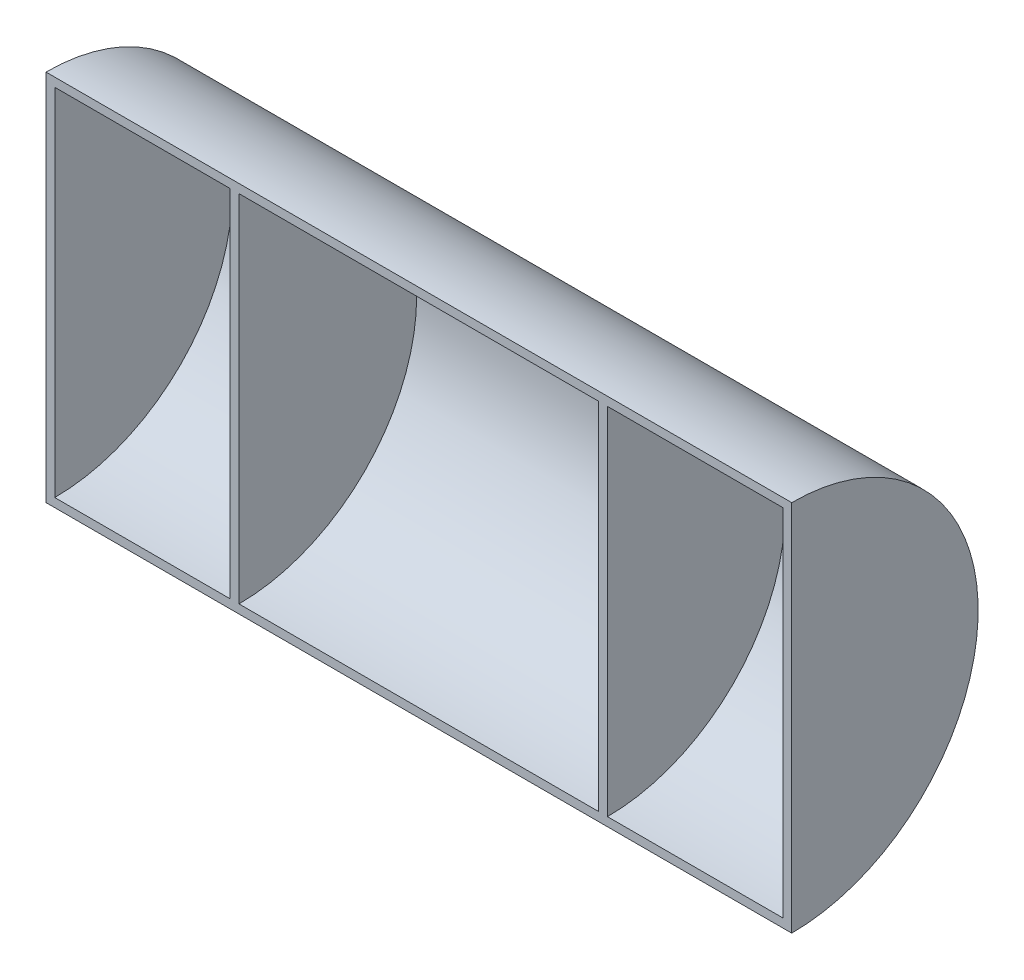
from build123d import *

# Parameters (mm, degrees)
PROFILE_EXTRUDE_DEPTH      = 170
PROFILE_SHELL_T            = -2
SUPPORT_EXTRUDE_REACH      = 182.312
SUPPORT_EXTRUDE_END_RADIUS = 40.5
SUPPORT_SKETCH_W           = 2
SUPPORT_SKETCH_H           = 81


with BuildPart() as part:
    # Profile Sketch → Profile Extrude (new body)
    with BuildSketch(Plane(origin=(0, 0, 0), x_dir=(0, 0, -1), z_dir=(1, 0, 0))):
        with BuildLine():
            Line((0, 42.5), (0, -42.5))
            ThreePointArc((0, -42.5), (42.5, 0), (0, 42.5))
        make_face()
    extrude(amount=-PROFILE_EXTRUDE_DEPTH)

    # Profile Shell
    profile_shell_openings = [part.faces().sort_by_distance(p)[0] for p in [
        (-85, 0, 0),
    ]]
    offset(amount=PROFILE_SHELL_T, openings=profile_shell_openings)

    # Support Extrude: up to this cylinder (the profile starts inside it)
    support_extrude_end = Plane(origin=(-85, 0, 0), z_dir=(1, 0, 0)) * Cylinder(SUPPORT_EXTRUDE_END_RADIUS, 530.624, mode=Mode.PRIVATE)
    # Support Sketch → Support Extrude (add, up to the surface)
    with BuildSketch(Plane.XY, mode=Mode.PRIVATE) as support_extrude_sk1:
        with Locations((-127, 0)):
            Rectangle(SUPPORT_SKETCH_W, SUPPORT_SKETCH_H)
    support_extrude_tool1 = extrude(support_extrude_sk1.sketch, amount=-SUPPORT_EXTRUDE_REACH, mode=Mode.PRIVATE) & support_extrude_end
    add(support_extrude_tool1.solids().sort_by_distance((-127, 0, 0))[0])
    # Support Sketch → Support Extrude (add, up to the surface)
    with BuildSketch(Plane.XY, mode=Mode.PRIVATE) as support_extrude_sk2:
        with Locations((-43, 0)):
            Rectangle(SUPPORT_SKETCH_W, SUPPORT_SKETCH_H)
    support_extrude_tool2 = extrude(support_extrude_sk2.sketch, amount=-SUPPORT_EXTRUDE_REACH, mode=Mode.PRIVATE) & support_extrude_end
    add(support_extrude_tool2.solids().sort_by_distance((-43, 0, 0))[0])


solid = part.part
